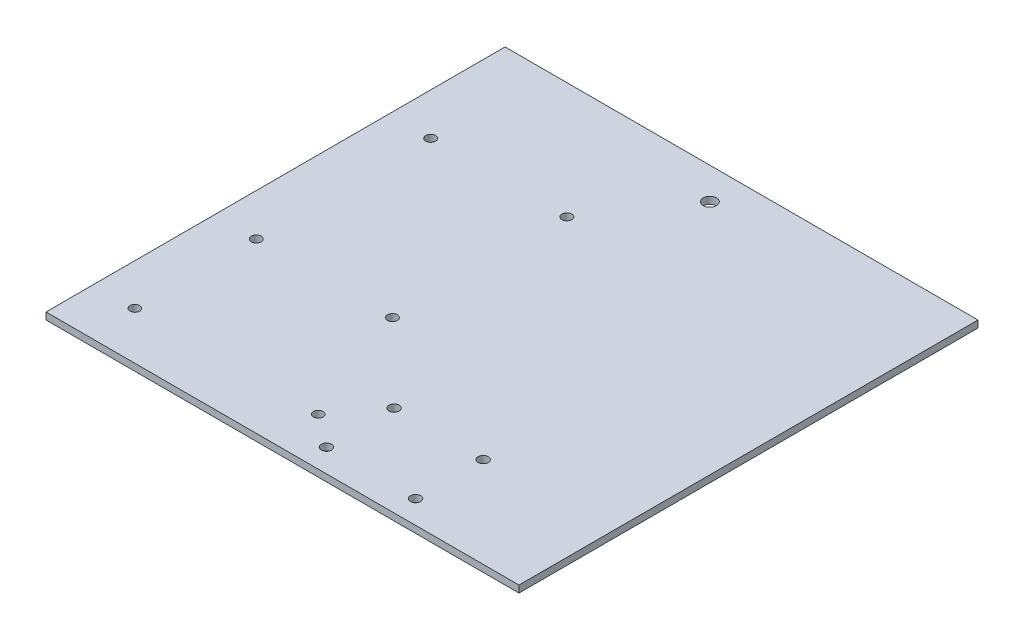
from build123d import *

# Parameters (mm, degrees)
SKETCH1_W           = 189.738
SKETCH1_H           = 184.15
BOSS_EXTRUDE1_DEPTH = 2.794
SKETCH2_R           = 2.6797
CUT_EXTRUDE1_DEPTH  = 133.233653893
SKETCH4_R           = 1.936199963
SKETCH4_R_2         = 2.048699992
SKETCH4_R_3         = 1.98
CUT_EXTRUDE3_DEPTH  = 133.233653893


with BuildPart() as part:
    # Sketch1 → Boss-Extrude1 (new body)
    with BuildSketch(Plane(origin=(0, 0, 0), x_dir=(1, 0, 0), z_dir=(0, 1, 0))):
        Rectangle(SKETCH1_W, SKETCH1_H)
    extrude(amount=BOSS_EXTRUDE1_DEPTH)

    # Sketch2 → Cut-Extrude1 (cut, through all)
    with BuildSketch(Plane(origin=(0, 2.794, 0), x_dir=(1, 0, 0), z_dir=(0, 1, 0))):
        with Locations((0, 79.375)):
            Circle(SKETCH2_R)
    extrude(amount=-CUT_EXTRUDE1_DEPTH, mode=Mode.SUBTRACT)

    # Sketch4 → Cut-Extrude3 (cut, through all)
    with BuildSketch(Plane(origin=(0, 2.794, 0), x_dir=(1, 0, 0), z_dir=(0, 1, 0))):
        with Locations((-78.2965, -72.992499938)):
            Circle(SKETCH4_R)
        with Locations((-4.7415, -72.9925)):
            Circle(SKETCH4_R)
        with Locations((8.356, -55.65)):
            Circle(SKETCH4_R_2)
        with Locations((44.106, -55.65)):
            Circle(SKETCH4_R_2)
        with Locations((44.106, -82.8)):
            Circle(SKETCH4_R_2)
        with Locations((8.356, -82.8)):
            Circle(SKETCH4_R_2)
        with Locations((-78.039, 45.43)):
            Circle(SKETCH4_R_3)
        with Locations((-23.429, 45.43)):
            Circle(SKETCH4_R_3)
        with Locations((-23.429, -24.545)):
            Circle(SKETCH4_R_3)
        with Locations((-78.039, -24.545)):
            Circle(SKETCH4_R_3)
    extrude(amount=-CUT_EXTRUDE3_DEPTH, mode=Mode.SUBTRACT)


solid = part.part
